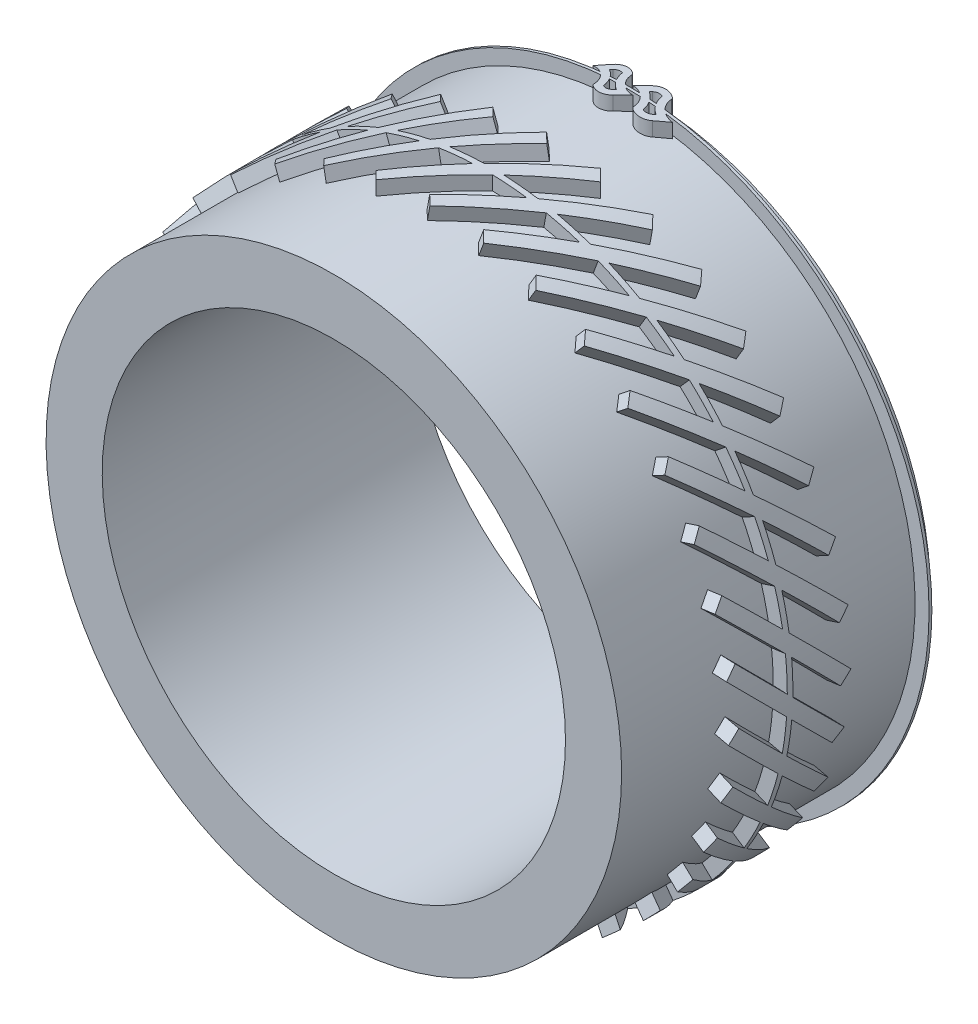
from build123d import *
from build123d.topology import SkipClean

# Parameters (mm, degrees)
SKETCH1_R                = 13.0175
SKETCH1_R_2              = 10.4775
BOSS_EXTRUDE1_DEPTH      = 6.985
SKETCH1_4_R              = 13.6525
SKETCH1_4_R_2            = 13.0175
BOSS_EXTRUDE2_DEPTH      = 0.127
BOSS_EXTRUDE3_REACH      = 22.532
BOSS_EXTRUDE3_END_RADIUS = 13.6525
CIRPATTERN1_COUNT        = 35
SKETCH1_5_R              = 10.4775
CUT_EXTRUDE2_DEPTH       = 6.985
BOSS_EXTRUDE4_REACH      = 22.532
BOSS_EXTRUDE4_END_RADIUS = 13.6525
SKETCH6_R                = 13.6525
SKETCH6_R_2              = 10.4775
BOSS_EXTRUDE6_DEPTH      = 0.0635


with BuildPart() as part:
    # Sketch1 → Boss-Extrude1 (new, symmetric)
    with BuildSketch(Plane.XY):
        Circle(SKETCH1_R)
        Circle(SKETCH1_R_2, mode=Mode.SUBTRACT)
    extrude(amount=BOSS_EXTRUDE1_DEPTH, both=True)

    # Sketch1<4> → Boss-Extrude2 (add, symmetric)
    with BuildSketch(Plane.XY):
        Circle(SKETCH1_4_R)
        Circle(SKETCH1_4_R_2, mode=Mode.SUBTRACT)
    extrude(amount=BOSS_EXTRUDE2_DEPTH, both=True)

    # Boss-Extrude3: up to this cylinder (the profile starts inside it)
    with SkipClean():  # the faces are left unmerged after this step: merging them gives an invalid solid
        boss_extrude3_end = Plane(origin=(0, 0, 0), z_dir=(0, 0, -1)) * Cylinder(BOSS_EXTRUDE3_END_RADIUS, 73.369, mode=Mode.PRIVATE)
        # Sketch4 → Boss-Extrude3 (add, up to the surface)
        with BuildSketch(Plane(origin=(0, 0, 0), x_dir=(1, 0, 0), z_dir=(0, 1, 0)), mode=Mode.PRIVATE) as boss_extrude3_sk1:
            Polygon((2.764506403, 2.315493597), (-2.315493597, -2.764506403), (-2.764506403, -2.315493597), (2.315493597, 2.764506403), align=None)
        boss_extrude3_tool1 = extrude(boss_extrude3_sk1.sketch, amount=BOSS_EXTRUDE3_REACH, mode=Mode.PRIVATE) & boss_extrude3_end
        boss_extrude3 = boss_extrude3_tool1.solids().sort_by_distance((0, 0, 0))[0]
        add(boss_extrude3)

    # CirPattern1: Boss-Extrude3 ×35 about axis
    with SkipClean():  # the faces are left unmerged after this step: merging them gives an invalid solid
        cirpattern1_axis = Axis((0, 0, 0), (0, 0, 1))
        for i in range(1, CIRPATTERN1_COUNT):
            add(boss_extrude3.rotate(cirpattern1_axis, i * 360 / CIRPATTERN1_COUNT))

    # Sketch1<5> → Cut-Extrude2 (cut, symmetric)
    with SkipClean():  # the faces are left unmerged after this step: merging them gives an invalid solid
        with BuildSketch(Plane.XY):
            Circle(SKETCH1_5_R)
        extrude(amount=CUT_EXTRUDE2_DEPTH, both=True, mode=Mode.SUBTRACT)

    # Boss-Extrude4: up to this cylinder (the profile starts inside it)
    with SkipClean():  # the faces are left unmerged after this step: merging them gives an invalid solid
        boss_extrude4_end = Plane(origin=(0, 0, -6.9726745), z_dir=(0, 0, -1)) * Cylinder(BOSS_EXTRUDE4_END_RADIUS, 73.369005, mode=Mode.PRIVATE)
        # Sketch4<9> → Boss-Extrude4 (add, up to the surface)
        with BuildSketch(Plane(origin=(0, 0, 0), x_dir=(1, 0, 0), z_dir=(0, 1, 0)), mode=Mode.PRIVATE) as boss_extrude4_sk1:
            with BuildLine():
                Line((0.449012806, 6.985), (0, 6.535987194))
                ThreePointArc((0, 6.535987194), (0.562628379, 6.312887348), (0.819472926, 5.764840714))
                ThreePointArc((0.819472926, 5.764840714), (0.833024451, 5.715004699), (0.865298351, 5.674685129))
                ThreePointArc((0.865298351, 5.674685129), (1.299953161, 5.52971965), (1.719012806, 5.715))
                Line((1.719012806, 5.715), (2.168020981, 6.164008393))
                ThreePointArc((2.168020981, 6.164008393), (1.605394035, 6.387111355), (1.348552686, 6.935159286))
                ThreePointArc((1.348552686, 6.935159286), (1.335001161, 6.984995301), (1.302727261, 7.025314871))
                ThreePointArc((1.302727261, 7.025314871), (0.868072451, 7.17028035), (0.449012806, 6.985))
            make_face()
            with BuildLine():
                Line((1.494506349, 5.939506349), (1.570757053, 6.01575709))
                ThreePointArc((1.570757053, 6.01575709), (1.217206765, 6.358819638), (1.041686429, 6.819126417))
                ThreePointArc((1.041686429, 6.819126417), (0.848091114, 6.849535908), (0.673519209, 6.760493597))
                Line((0.673519209, 6.760493597), (0.597265836, 6.684240224))
                ThreePointArc((0.597265836, 6.684240224), (0.950816802, 6.341179288), (1.126338746, 5.880873804))
                ThreePointArc((1.126338746, 5.880873804), (1.319934256, 5.850464054), (1.494506349, 5.939506349))
            make_face(mode=Mode.SUBTRACT)
        boss_extrude4_tool1 = extrude(boss_extrude4_sk1.sketch, amount=BOSS_EXTRUDE4_REACH, mode=Mode.PRIVATE) & boss_extrude4_end
        add(boss_extrude4_tool1.solids().sort_by_distance((1.310757, 0, -6.972672))[0])
        # Sketch4<9> → Boss-Extrude4 (add, up to the surface)
        with BuildSketch(Plane(origin=(0, 0, 0), x_dir=(1, 0, 0), z_dir=(0, 1, 0)), mode=Mode.PRIVATE) as boss_extrude4_sk2:
            with BuildLine():
                Line((-1.347032123, 6.985008827), (-1.796043827, 6.535997955))
                ThreePointArc((-1.796043827, 6.535997955), (-1.233416788, 6.312894962), (-0.976575383, 5.764846951))
                ThreePointArc((-0.976575383, 5.764846951), (-0.963024006, 5.715010895), (-0.930750227, 5.67469123))
                ThreePointArc((-0.930750227, 5.67469123), (-0.496097044, 5.529726269), (-0.077038418, 5.715004699))
                Line((-0.077038418, 5.715004699), (0.371976706, 6.164015186))
                ThreePointArc((0.371976706, 6.164015186), (-0.190649815, 6.387117264), (-0.44749213, 6.935163944))
                ThreePointArc((-0.44749213, 6.935163944), (-0.461043506, 6.985), (-0.493317286, 7.025319666))
                ThreePointArc((-0.493317286, 7.025319666), (-0.927971509, 7.170287285), (-1.347032123, 6.985008827))
            make_face()
            with BuildLine():
                Line((-0.301543662, 5.939512261), (-0.225289899, 6.015765236))
                ThreePointArc((-0.225289899, 6.015765236), (-0.578838459, 6.358827028), (-0.75435833, 6.819132092))
                ThreePointArc((-0.75435833, 6.819132092), (-0.947953918, 6.849543008), (-1.122525928, 6.760502216))
                Line((-1.122525928, 6.760502216), (-1.198779343, 6.684248942))
                ThreePointArc((-1.198779343, 6.684248942), (-0.845229319, 6.341186391), (-0.669709119, 5.880879761))
                ThreePointArc((-0.669709119, 5.880879761), (-0.476114918, 5.850470731), (-0.301543662, 5.939512261))
            make_face(mode=Mode.SUBTRACT)
        boss_extrude4_tool2 = extrude(boss_extrude4_sk2.sketch, amount=BOSS_EXTRUDE4_REACH, mode=Mode.PRIVATE) & boss_extrude4_end
        add(boss_extrude4_tool2.solids().sort_by_distance((-0.485288, 0, -6.972677))[0])

    # Sketch6 → Boss-Extrude6 (add, symmetric)
    with BuildSketch(Plane(origin=(0, 0, -6.35), x_dir=(-1, 0, 0), z_dir=(0, 0, -1))):
        with Locations(Location((0, 0, 0), (0, 0, 359.846656172))):
            Circle(SKETCH6_R)
        with Locations(Location((0, 0, 0), (0, 0, 80.129660074))):
            Circle(SKETCH6_R_2, mode=Mode.SUBTRACT)
    extrude(amount=BOSS_EXTRUDE6_DEPTH, both=True)


solid = part.part
